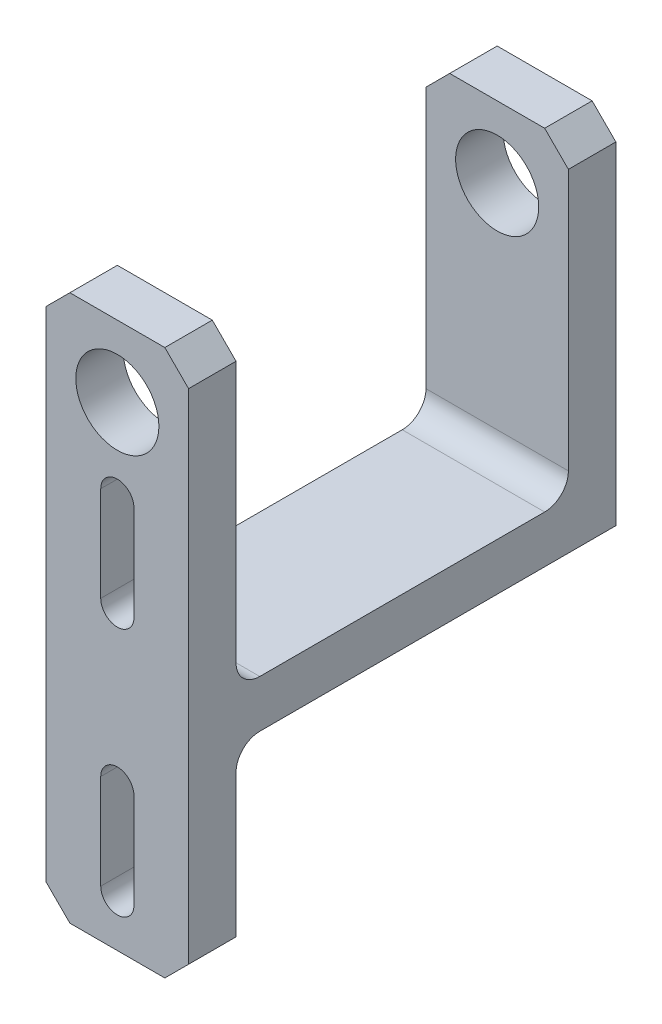
from build123d import *

# Parameters (mm, degrees)
EXTRUDE_THIN1_START            = -30
EXTRUDE_THIN1_DEPTH            = 60
EXTRUDE_THIN1_2_OUTLINE_W      = 230
EXTRUDE_THIN1_2_OUTLINE_H      = 20
EXTRUDE_THIN1_2_DEPTH          = 60
FILLET1_R                      = 10
CUT_EXTRUDE1_DEPTH             = 237.22023622
CUT_EXTRUDE1_DEPTH_BACK        = 237.22023622
SKETCH3_R                      = 17.5
CUT_EXTRUDE2_REACH             = 238.22
CUT_EXTRUDE2_DIRECTION_2_DEPTH = 237.22023622
CHAMFER1_SIZE                  = 10


# Read off the part's stored shape, not the designer's step: Extrude-Thin1
with BuildPart() as part:
    # Extrude-Thin1 outline → Extrude-Thin1 (new body)
    with BuildSketch(Plane.YZ.offset(EXTRUDE_THIN1_START)):
        Polygon((0, 0), (150, 0), (150, 20), (20, 20), (20, 160), (0, 160), align=None)
    extrude(amount=EXTRUDE_THIN1_DEPTH)


with BuildPart() as body_2:
    # Extrude-Thin1 2 outline → Extrude-Thin1 2 (new body)
    with BuildSketch(Plane.YZ.offset(EXTRUDE_THIN1_START)):
        with Locations((35, 170)):
            Rectangle(EXTRUDE_THIN1_2_OUTLINE_W, EXTRUDE_THIN1_2_OUTLINE_H)
    extrude(amount=EXTRUDE_THIN1_2_DEPTH)

    # Combine1: union part
    add(part.part)

    # Fillet1
    fillet1_edges = [body_2.edges().sort_by_distance(p)[0] for p in [
        (0, 20, 20),
        (0, 20, 160),
        (0, 0, 160),
    ]]
    fillet(fillet1_edges, radius=FILLET1_R)

    # Sketch3 → Cut-Extrude1 (cut, two sides: drawn at the far end of the back side and taken through both)
    with BuildSketch(Plane.XY.offset(180).offset(-CUT_EXTRUDE1_DEPTH_BACK)):
        with Locations((0, 120)):
            Circle(SKETCH3_R)
    extrude(amount=CUT_EXTRUDE1_DEPTH + CUT_EXTRUDE1_DEPTH_BACK, mode=Mode.SUBTRACT)

    # Sketch2 → Cut-Extrude2 (cut, up to next)
    with BuildSketch(Plane.XY.offset(180), mode=Mode.PRIVATE) as cut_extrude2_sk1:
        with BuildLine():
            Line((7, 85), (7, 45))
            ThreePointArc((7, 45), (0, 38), (-7, 45))
            Line((-7, 45), (-7, 85))
            ThreePointArc((-7, 85), (0, 92), (7, 85))
        make_face()
    cut_extrude2_tool1 = extrude(cut_extrude2_sk1.sketch, amount=-CUT_EXTRUDE2_REACH, mode=Mode.PRIVATE) & body_2.part
    # Sketch2 → Cut-Extrude2 (cut, up to next)
    with BuildSketch(Plane.XY.offset(180), mode=Mode.PRIVATE) as cut_extrude2_sk2:
        with BuildLine():
            Line((7, -20), (7, -60))
            ThreePointArc((7, -60), (0, -67), (-7, -60))
            Line((-7, -60), (-7, -20))
            ThreePointArc((-7, -20), (0, -13), (7, -20))
        make_face()
    cut_extrude2_tool2 = extrude(cut_extrude2_sk2.sketch, amount=-CUT_EXTRUDE2_REACH, mode=Mode.PRIVATE) & body_2.part
    add(cut_extrude2_tool1.solids().sort_by_distance((0, 65, 180))[0], mode=Mode.SUBTRACT)
    add(cut_extrude2_tool2.solids().sort_by_distance((0, -40, 180))[0], mode=Mode.SUBTRACT)

    # Sketch2 → Cut-Extrude2 direction 2 (cut)
    with BuildSketch(Plane.XY.offset(180)):
        with BuildLine():
            Line((7, 85), (7, 45))
            ThreePointArc((7, 45), (0, 38), (-7, 45))
            Line((-7, 45), (-7, 85))
            ThreePointArc((-7, 85), (0, 92), (7, 85))
        make_face()
        with BuildLine():
            Line((7, -20), (7, -60))
            ThreePointArc((7, -60), (0, -67), (-7, -60))
            Line((-7, -60), (-7, -20))
            ThreePointArc((-7, -20), (0, -13), (7, -20))
        make_face()
    extrude(amount=CUT_EXTRUDE2_DIRECTION_2_DEPTH, mode=Mode.SUBTRACT)

    # Chamfer1
    chamfer1_edges = [body_2.edges().sort_by_distance(p)[0] for p in [
        (30, -80, 170),
        (30, 150, 10),
        (-30, 150, 10),
        (-30, -80, 170),
        (-30, 150, 170),
        (30, 150, 170),
    ]]
    chamfer(chamfer1_edges, length=CHAMFER1_SIZE)


solid = body_2.part
